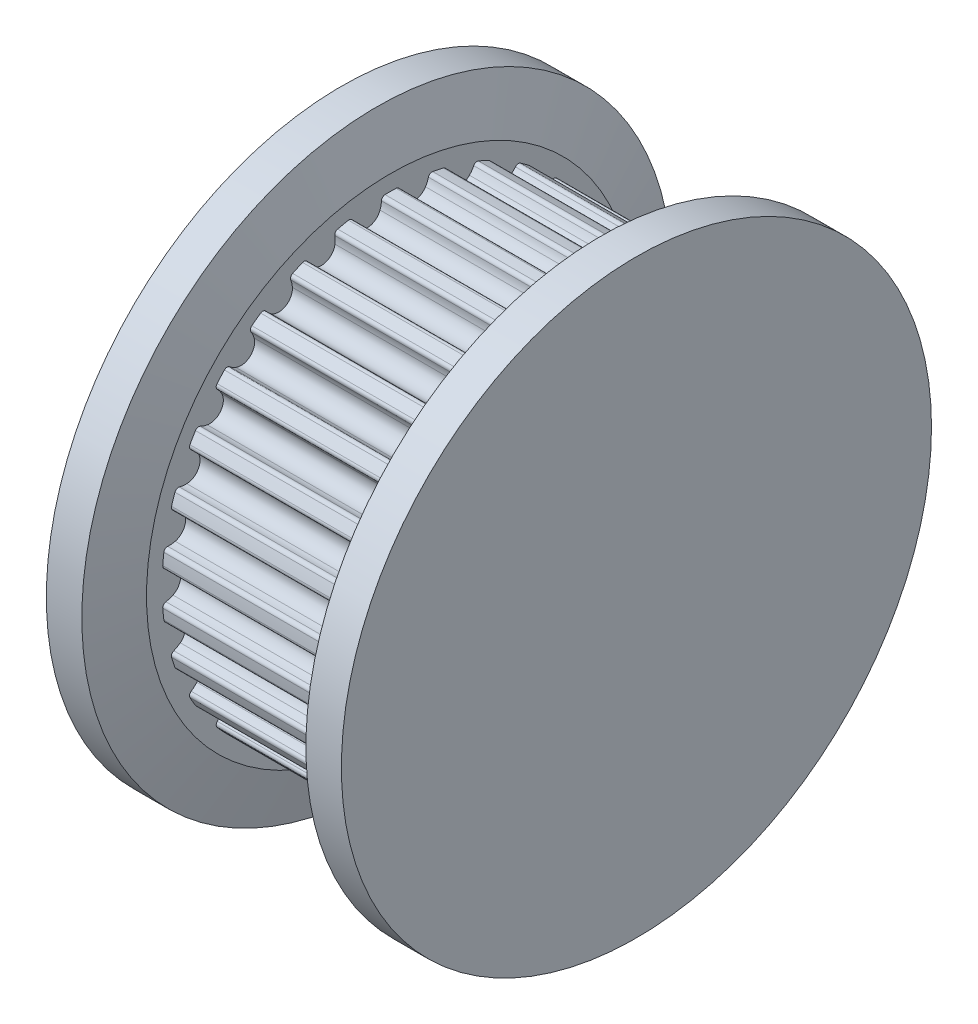
from build123d import *

# Parameters (mm, degrees)
BOSS_EXTRUDE1_DEPTH = 4


with BuildPart() as part:
    # Teeth → Boss-Extrude1 (new, symmetric)
    with BuildSketch(Plane(origin=(0, 0, 0), x_dir=(0, 0, -1), z_dir=(1, 0, 0))):
        with BuildLine():
            ThreePointArc((9.265037895, -0.749407376), (9.255373868, -0.860577234), (9.244375978, -0.971623068))
            ThreePointArc((9.244375978, -0.971623068), (9.232045811, -1.082528873), (9.218385142, -1.193278668))
            ThreePointArc((9.218385142, -1.193278668), (9.165223738, -1.289612833), (9.060624925, -1.323752174))
            ThreePointArc((9.060624925, -1.323752174), (8.90837436, -1.326213349), (8.758262534, -1.351761965))
            ThreePointArc((8.758262534, -1.351761965), (8.349896739, -1.774825341), (8.550882079, -2.327410299))
            ThreePointArc((8.550882079, -2.327410299), (8.677624497, -2.411806101), (8.815711259, -2.47598038))
            ThreePointArc((8.815711259, -2.47598038), (8.897381309, -2.54971239), (8.906764033, -2.659340721))
            ThreePointArc((8.906764033, -2.659340721), (8.874197675, -2.766071987), (8.840352389, -2.872404613))
            ThreePointArc((8.840352389, -2.872404613), (8.805233051, -2.978323274), (8.768844724, -3.083812707))
            ThreePointArc((8.768844724, -3.083812707), (8.696816025, -3.166988863), (8.587404979, -3.178634861))
            ThreePointArc((8.587404979, -3.178634861), (8.437969747, -3.149387581), (8.285826368, -3.143167895))
            ThreePointArc((8.285826368, -3.143167895), (7.798424524, -3.472082299), (7.880128979, -4.054379151))
            ThreePointArc((7.880128979, -4.054379151), (7.986554897, -4.163281933), (8.10828155, -4.254763702))
            ThreePointArc((8.10828155, -4.254763702), (8.172837166, -4.343864649), (8.159221844, -4.453048116))
            ThreePointArc((8.159221844, -4.453048116), (8.105176461, -4.550676121), (8.049962979, -4.647648293))
            ThreePointArc((8.049962979, -4.647648293), (7.993589355, -4.743950657), (7.936063714, -4.839569334))
            ThreePointArc((7.936063714, -4.839569334), (7.84831572, -4.905952282), (7.738874228, -4.894595952))
            ThreePointArc((7.738874228, -4.894595952), (7.598785366, -4.834918463), (7.451259831, -4.797202305))
            ThreePointArc((7.451259831, -4.797202305), (6.906123737, -5.017592598), (6.86497643, -5.604152179))
            ThreePointArc((6.86497643, -5.604152179), (6.946434525, -5.732802366), (7.046481028, -5.847593434))
            ThreePointArc((7.046481028, -5.847593434), (7.091100821, -5.948169178), (7.055082507, -6.052135939))
            ThreePointArc((7.055082507, -6.052135939), (6.981920142, -6.136393871), (6.907751559, -6.219767441))
            ThreePointArc((6.907751559, -6.219767441), (6.832587447, -6.302244632), (6.756438638, -6.383813558))
            ThreePointArc((6.756438638, -6.383813558), (6.656806357, -6.430502046), (6.552117538, -6.396639713))
            ThreePointArc((6.552117538, -6.396639713), (6.427497601, -6.309140208), (6.291037483, -6.241575955))
            ThreePointArc((6.291037483, -6.241575955), (5.711992203, -6.343810025), (5.549791469, -6.908996865))
            ThreePointArc((5.549791469, -6.908996865), (5.602721631, -7.051771827), (5.676715474, -7.184855272))
            ThreePointArc((5.676715474, -7.184855272), (5.699449344, -7.292510172), (5.642602211, -7.386716381))
            ThreePointArc((5.642602211, -7.386716381), (5.55352041, -7.453921764), (5.463638249, -7.520052905))
            ThreePointArc((5.463638249, -7.520052905), (5.37296868, -7.585100274), (5.281524773, -7.649054496))
            ThreePointArc((5.281524773, -7.649054496), (5.174362614, -7.674008013), (5.079001872, -7.619119624))
            ThreePointArc((5.079001872, -7.619119624), (4.975297349, -7.507622251), (4.85586661, -7.413162786))
            ThreePointArc((4.85586661, -7.413162786), (4.2682192, -7.392772512), (3.99205399, -7.911885235))
            ThreePointArc((3.99205399, -7.911885235), (4.014142917, -8.062545021), (4.058850213, -8.208104459))
            ThreePointArc((4.058850213, -8.208104459), (4.058704581, -8.318133478), (3.983513122, -8.398461872))
            ThreePointArc((3.983513122, -8.398461872), (3.882405187, -8.445677508), (3.78073773, -8.491675973))
            ThreePointArc((3.78073773, -8.491675973), (3.678525401, -8.536450638), (3.575782931, -8.579995049))
            ThreePointArc((3.575782931, -8.579995049), (3.465774395, -8.582123005), (3.383909451, -8.508607446))
            ThreePointArc((3.383909451, -8.508607446), (3.305652729, -8.377985177), (3.208471065, -8.26075883))
            ThreePointArc((3.208471065, -8.26075883), (2.637904537, -8.118635366), (2.259844595, -8.568986255))
            ThreePointArc((2.259844595, -8.568986255), (2.250126896, -8.72094631), (2.263593721, -8.872620093))
            ThreePointArc((2.263593721, -8.872620093), (2.240574952, -8.980214436), (2.150325395, -9.043154279))
            ThreePointArc((2.150325395, -9.043154279), (2.041610228, -9.068316618), (1.93260083, -9.092172053))
            ThreePointArc((1.93260083, -9.092172053), (1.823312909, -9.114717146), (1.713762217, -9.135948647))
            ThreePointArc((1.713762217, -9.135948647), (1.605715204, -9.115158041), (1.54092395, -9.026228295))
            ThreePointArc((1.54092395, -9.026228295), (1.491535222, -8.882189948), (1.420849939, -8.747320074))
            ThreePointArc((1.420849939, -8.747320074), (0.892300788, -8.489674897), (0.428869148, -8.851581456))
            ThreePointArc((0.428869148, -8.851581456), (0.387769532, -8.998200396), (0.369407321, -9.149359654))
            ThreePointArc((0.369407321, -9.149359654), (0.324521446, -9.249816931), (0.223158129, -9.292617449))
            ThreePointArc((0.223158129, -9.292617449), (0.111587106, -9.294626777), (0, -9.295296586))
            ThreePointArc((0, -9.295296586), (-0.111587106, -9.294626777), (-0.22315813, -9.292617449))
            ThreePointArc((-0.22315813, -9.292617449), (-0.324521446, -9.249816931), (-0.369407322, -9.149359654))
            ThreePointArc((-0.369407322, -9.149359654), (-0.387769532, -8.998200396), (-0.428869148, -8.851581456))
            ThreePointArc((-0.428869148, -8.851581456), (-0.892300788, -8.489674897), (-1.420849939, -8.747320074))
            ThreePointArc((-1.420849939, -8.747320074), (-1.491535222, -8.882189948), (-1.54092395, -9.026228295))
            ThreePointArc((-1.54092395, -9.026228295), (-1.605715204, -9.115158041), (-1.713762217, -9.135948647))
            ThreePointArc((-1.713762217, -9.135948647), (-1.823312909, -9.114717146), (-1.93260083, -9.092172053))
            ThreePointArc((-1.93260083, -9.092172053), (-2.041610228, -9.068316618), (-2.150325395, -9.043154279))
            ThreePointArc((-2.150325395, -9.043154279), (-2.240574952, -8.980214436), (-2.263593721, -8.872620093))
            ThreePointArc((-2.263593721, -8.872620093), (-2.250126896, -8.72094631), (-2.259844595, -8.568986255))
            ThreePointArc((-2.259844595, -8.568986255), (-2.637904537, -8.118635366), (-3.208471065, -8.26075883))
            ThreePointArc((-3.208471065, -8.26075883), (-3.305652729, -8.377985177), (-3.383909451, -8.508607446))
            ThreePointArc((-3.383909451, -8.508607446), (-3.465774395, -8.582123005), (-3.575782931, -8.579995049))
            ThreePointArc((-3.575782931, -8.579995049), (-3.678525401, -8.536450638), (-3.78073773, -8.491675973))
            ThreePointArc((-3.78073773, -8.491675973), (-3.882405188, -8.445677508), (-3.983513122, -8.398461872))
            ThreePointArc((-3.983513122, -8.398461872), (-4.058704581, -8.318133478), (-4.058850213, -8.208104459))
            ThreePointArc((-4.058850213, -8.208104459), (-4.014142917, -8.062545021), (-3.99205399, -7.911885235))
            ThreePointArc((-3.99205399, -7.911885235), (-4.2682192, -7.392772512), (-4.85586661, -7.413162786))
            ThreePointArc((-4.85586661, -7.413162786), (-4.975297349, -7.507622251), (-5.079001872, -7.619119624))
            ThreePointArc((-5.079001872, -7.619119624), (-5.174362614, -7.674008013), (-5.281524773, -7.649054496))
            ThreePointArc((-5.281524773, -7.649054496), (-5.372968681, -7.585100274), (-5.463638249, -7.520052905))
            ThreePointArc((-5.463638249, -7.520052905), (-5.55352041, -7.453921764), (-5.642602211, -7.386716381))
            ThreePointArc((-5.642602211, -7.386716381), (-5.699449344, -7.292510172), (-5.676715474, -7.184855272))
            ThreePointArc((-5.676715474, -7.184855272), (-5.602721631, -7.051771827), (-5.549791469, -6.908996865))
            ThreePointArc((-5.549791469, -6.908996865), (-5.711992203, -6.343810025), (-6.291037484, -6.241575955))
            ThreePointArc((-6.291037484, -6.241575955), (-6.427497601, -6.309140208), (-6.552117538, -6.396639713))
            ThreePointArc((-6.552117538, -6.396639713), (-6.656806357, -6.430502046), (-6.756438638, -6.383813558))
            ThreePointArc((-6.756438638, -6.383813558), (-6.832587447, -6.302244632), (-6.907751559, -6.219767441))
            ThreePointArc((-6.907751559, -6.219767441), (-6.981920142, -6.136393871), (-7.055082507, -6.052135939))
            ThreePointArc((-7.055082507, -6.052135939), (-7.091100821, -5.948169178), (-7.046481029, -5.847593434))
            ThreePointArc((-7.046481029, -5.847593434), (-6.946434525, -5.732802366), (-6.86497643, -5.604152179))
            ThreePointArc((-6.86497643, -5.604152179), (-6.906123737, -5.017592598), (-7.451259831, -4.797202305))
            ThreePointArc((-7.451259831, -4.797202305), (-7.598785366, -4.834918463), (-7.738874228, -4.894595952))
            ThreePointArc((-7.738874228, -4.894595952), (-7.84831572, -4.905952282), (-7.936063714, -4.839569334))
            ThreePointArc((-7.936063714, -4.839569334), (-7.993589355, -4.743950657), (-8.049962979, -4.647648293))
            ThreePointArc((-8.049962979, -4.647648293), (-8.105176461, -4.550676121), (-8.159221844, -4.453048116))
            ThreePointArc((-8.159221844, -4.453048116), (-8.172837166, -4.343864649), (-8.10828155, -4.254763702))
            ThreePointArc((-8.10828155, -4.254763702), (-7.986554897, -4.163281933), (-7.880128979, -4.054379151))
            ThreePointArc((-7.880128979, -4.054379151), (-7.798424525, -3.472082299), (-8.285826369, -3.143167895))
            ThreePointArc((-8.285826369, -3.143167895), (-8.437969747, -3.149387581), (-8.587404979, -3.178634861))
            ThreePointArc((-8.587404979, -3.178634861), (-8.696816025, -3.166988863), (-8.768844724, -3.083812707))
            ThreePointArc((-8.768844724, -3.083812707), (-8.805233051, -2.978323274), (-8.840352389, -2.872404613))
            ThreePointArc((-8.840352389, -2.872404613), (-8.874197675, -2.766071987), (-8.906764033, -2.659340721))
            ThreePointArc((-8.906764033, -2.659340721), (-8.897381309, -2.54971239), (-8.815711259, -2.47598038))
            ThreePointArc((-8.815711259, -2.47598038), (-8.677624497, -2.411806101), (-8.550882079, -2.327410299))
            ThreePointArc((-8.550882079, -2.327410299), (-8.34989674, -1.774825341), (-8.758262534, -1.351761965))
            ThreePointArc((-8.758262534, -1.351761965), (-8.90837436, -1.326213349), (-9.060624925, -1.323752174))
            ThreePointArc((-9.060624925, -1.323752174), (-9.165223738, -1.289612833), (-9.218385142, -1.193278668))
            ThreePointArc((-9.218385142, -1.193278668), (-9.232045811, -1.082528873), (-9.244375978, -0.971623068))
            ThreePointArc((-9.244375978, -0.971623068), (-9.255373868, -0.860577234), (-9.265037895, -0.749407376))
            ThreePointArc((-9.265037895, -0.749407376), (-9.233067195, -0.644125465), (-9.137852084, -0.588984835))
            ThreePointArc((-9.137852084, -0.588984835), (-8.989440266, -0.55492277), (-8.8479206, -0.498722449))
            ThreePointArc((-8.8479206, -0.498722449), (-8.5364384, 0), (-8.8479206, 0.498722449))
            ThreePointArc((-8.8479206, 0.498722449), (-8.989440266, 0.55492277), (-9.137852084, 0.588984835))
            ThreePointArc((-9.137852084, 0.588984835), (-9.233067195, 0.644125465), (-9.265037895, 0.749407376))
            ThreePointArc((-9.265037895, 0.749407376), (-9.255373868, 0.860577234), (-9.244375978, 0.971623068))
            ThreePointArc((-9.244375978, 0.971623068), (-9.232045811, 1.082528873), (-9.218385142, 1.193278668))
            ThreePointArc((-9.218385142, 1.193278668), (-9.165223738, 1.289612833), (-9.060624925, 1.323752174))
            ThreePointArc((-9.060624925, 1.323752174), (-8.90837436, 1.326213349), (-8.758262534, 1.351761965))
            ThreePointArc((-8.758262534, 1.351761965), (-8.34989674, 1.774825341), (-8.550882079, 2.327410299))
            ThreePointArc((-8.550882079, 2.327410299), (-8.677624497, 2.411806101), (-8.815711259, 2.47598038))
            ThreePointArc((-8.815711259, 2.47598038), (-8.897381309, 2.54971239), (-8.906764033, 2.659340721))
            ThreePointArc((-8.906764033, 2.659340721), (-8.874197675, 2.766071987), (-8.840352389, 2.872404613))
            ThreePointArc((-8.840352389, 2.872404613), (-8.805233051, 2.978323274), (-8.768844724, 3.083812707))
            ThreePointArc((-8.768844724, 3.083812707), (-8.696816025, 3.166988863), (-8.587404979, 3.178634861))
            ThreePointArc((-8.587404979, 3.178634861), (-8.437969747, 3.149387581), (-8.285826369, 3.143167895))
            ThreePointArc((-8.285826369, 3.143167895), (-7.798424525, 3.472082299), (-7.880128979, 4.054379151))
            ThreePointArc((-7.880128979, 4.054379151), (-7.986554897, 4.163281933), (-8.10828155, 4.254763702))
            ThreePointArc((-8.10828155, 4.254763702), (-8.172837166, 4.343864649), (-8.159221844, 4.453048116))
            ThreePointArc((-8.159221844, 4.453048116), (-8.105176461, 4.550676121), (-8.049962979, 4.647648293))
            ThreePointArc((-8.049962979, 4.647648293), (-7.993589355, 4.743950657), (-7.936063714, 4.839569334))
            ThreePointArc((-7.936063714, 4.839569334), (-7.84831572, 4.905952282), (-7.738874228, 4.894595952))
            ThreePointArc((-7.738874228, 4.894595952), (-7.598785366, 4.834918463), (-7.451259831, 4.797202305))
            ThreePointArc((-7.451259831, 4.797202305), (-6.906123737, 5.017592598), (-6.86497643, 5.604152179))
            ThreePointArc((-6.86497643, 5.604152179), (-6.946434525, 5.732802366), (-7.046481029, 5.847593434))
            ThreePointArc((-7.046481029, 5.847593434), (-7.091100821, 5.948169178), (-7.055082507, 6.052135939))
            ThreePointArc((-7.055082507, 6.052135939), (-6.981920142, 6.136393871), (-6.907751559, 6.219767441))
            ThreePointArc((-6.907751559, 6.219767441), (-6.832587447, 6.302244632), (-6.756438638, 6.383813558))
            ThreePointArc((-6.756438638, 6.383813558), (-6.656806357, 6.430502046), (-6.552117538, 6.396639713))
            ThreePointArc((-6.552117538, 6.396639713), (-6.427497601, 6.309140208), (-6.291037484, 6.241575955))
            ThreePointArc((-6.291037484, 6.241575955), (-5.711992203, 6.343810025), (-5.549791469, 6.908996865))
            ThreePointArc((-5.549791469, 6.908996865), (-5.602721631, 7.051771827), (-5.676715474, 7.184855272))
            ThreePointArc((-5.676715474, 7.184855272), (-5.699449344, 7.292510172), (-5.642602211, 7.386716381))
            ThreePointArc((-5.642602211, 7.386716381), (-5.55352041, 7.453921764), (-5.463638249, 7.520052905))
            ThreePointArc((-5.463638249, 7.520052905), (-5.372968681, 7.585100274), (-5.281524773, 7.649054496))
            ThreePointArc((-5.281524773, 7.649054496), (-5.174362614, 7.674008013), (-5.079001872, 7.619119624))
            ThreePointArc((-5.079001872, 7.619119624), (-4.975297349, 7.507622251), (-4.85586661, 7.413162786))
            ThreePointArc((-4.85586661, 7.413162786), (-4.2682192, 7.392772512), (-3.99205399, 7.911885235))
            ThreePointArc((-3.99205399, 7.911885235), (-4.014142917, 8.062545021), (-4.058850213, 8.208104459))
            ThreePointArc((-4.058850213, 8.208104459), (-4.058704581, 8.318133478), (-3.983513122, 8.398461872))
            ThreePointArc((-3.983513122, 8.398461872), (-3.882405188, 8.445677508), (-3.78073773, 8.491675973))
            ThreePointArc((-3.78073773, 8.491675973), (-3.678525401, 8.536450638), (-3.575782931, 8.579995049))
            ThreePointArc((-3.575782931, 8.579995049), (-3.465774395, 8.582123005), (-3.383909451, 8.508607446))
            ThreePointArc((-3.383909451, 8.508607446), (-3.305652729, 8.377985177), (-3.208471065, 8.26075883))
            ThreePointArc((-3.208471065, 8.26075883), (-2.637904537, 8.118635366), (-2.259844595, 8.568986255))
            ThreePointArc((-2.259844595, 8.568986255), (-2.250126896, 8.72094631), (-2.263593721, 8.872620093))
            ThreePointArc((-2.263593721, 8.872620093), (-2.240574952, 8.980214436), (-2.150325395, 9.043154279))
            ThreePointArc((-2.150325395, 9.043154279), (-2.041610228, 9.068316618), (-1.93260083, 9.092172053))
            ThreePointArc((-1.93260083, 9.092172053), (-1.823312909, 9.114717146), (-1.713762217, 9.135948647))
            ThreePointArc((-1.713762217, 9.135948647), (-1.605715204, 9.115158041), (-1.54092395, 9.026228295))
            ThreePointArc((-1.54092395, 9.026228295), (-1.491535222, 8.882189948), (-1.420849939, 8.747320074))
            ThreePointArc((-1.420849939, 8.747320074), (-0.892300788, 8.489674897), (-0.428869148, 8.851581456))
            ThreePointArc((-0.428869148, 8.851581456), (-0.387769532, 8.998200396), (-0.369407322, 9.149359654))
            ThreePointArc((-0.369407322, 9.149359654), (-0.324521446, 9.249816931), (-0.22315813, 9.292617449))
            ThreePointArc((-0.22315813, 9.292617449), (-0.111587106, 9.294626777), (0, 9.295296586))
            ThreePointArc((0, 9.295296586), (0.111587106, 9.294626777), (0.223158129, 9.292617449))
            ThreePointArc((0.223158129, 9.292617449), (0.324521446, 9.249816931), (0.369407321, 9.149359654))
            ThreePointArc((0.369407321, 9.149359654), (0.387769532, 8.998200396), (0.428869148, 8.851581456))
            ThreePointArc((0.428869148, 8.851581456), (0.892300788, 8.489674897), (1.420849939, 8.747320074))
            ThreePointArc((1.420849939, 8.747320074), (1.491535222, 8.882189948), (1.54092395, 9.026228295))
            ThreePointArc((1.54092395, 9.026228295), (1.605715204, 9.115158041), (1.713762217, 9.135948647))
            ThreePointArc((1.713762217, 9.135948647), (1.823312909, 9.114717146), (1.93260083, 9.092172053))
            ThreePointArc((1.93260083, 9.092172053), (2.041610228, 9.068316618), (2.150325395, 9.043154279))
            ThreePointArc((2.150325395, 9.043154279), (2.240574952, 8.980214436), (2.263593721, 8.872620093))
            ThreePointArc((2.263593721, 8.872620093), (2.250126896, 8.72094631), (2.259844595, 8.568986255))
            ThreePointArc((2.259844595, 8.568986255), (2.637904537, 8.118635366), (3.208471065, 8.26075883))
            ThreePointArc((3.208471065, 8.26075883), (3.305652729, 8.377985177), (3.383909451, 8.508607446))
            ThreePointArc((3.383909451, 8.508607446), (3.465774395, 8.582123005), (3.575782931, 8.579995049))
            ThreePointArc((3.575782931, 8.579995049), (3.678525401, 8.536450638), (3.78073773, 8.491675973))
            ThreePointArc((3.78073773, 8.491675973), (3.882405187, 8.445677508), (3.983513122, 8.398461872))
            ThreePointArc((3.983513122, 8.398461872), (4.058704581, 8.318133478), (4.058850213, 8.208104459))
            ThreePointArc((4.058850213, 8.208104459), (4.014142917, 8.062545021), (3.99205399, 7.911885235))
            ThreePointArc((3.99205399, 7.911885235), (4.2682192, 7.392772512), (4.85586661, 7.413162786))
            ThreePointArc((4.85586661, 7.413162786), (4.975297349, 7.507622251), (5.079001872, 7.619119624))
            ThreePointArc((5.079001872, 7.619119624), (5.174362614, 7.674008013), (5.281524773, 7.649054496))
            ThreePointArc((5.281524773, 7.649054496), (5.37296868, 7.585100274), (5.463638249, 7.520052905))
            ThreePointArc((5.463638249, 7.520052905), (5.55352041, 7.453921764), (5.642602211, 7.386716381))
            ThreePointArc((5.642602211, 7.386716381), (5.699449344, 7.292510172), (5.676715474, 7.184855272))
            ThreePointArc((5.676715474, 7.184855272), (5.602721631, 7.051771827), (5.549791469, 6.908996865))
            ThreePointArc((5.549791469, 6.908996865), (5.711992203, 6.343810025), (6.291037483, 6.241575955))
            ThreePointArc((6.291037483, 6.241575955), (6.427497601, 6.309140208), (6.552117538, 6.396639713))
            ThreePointArc((6.552117538, 6.396639713), (6.656806357, 6.430502046), (6.756438638, 6.383813558))
            ThreePointArc((6.756438638, 6.383813558), (6.832587447, 6.302244632), (6.907751559, 6.219767441))
            ThreePointArc((6.907751559, 6.219767441), (6.981920142, 6.136393871), (7.055082507, 6.052135939))
            ThreePointArc((7.055082507, 6.052135939), (7.091100821, 5.948169178), (7.046481028, 5.847593434))
            ThreePointArc((7.046481028, 5.847593434), (6.946434525, 5.732802366), (6.86497643, 5.604152179))
            ThreePointArc((6.86497643, 5.604152179), (6.906123737, 5.017592598), (7.451259831, 4.797202305))
            ThreePointArc((7.451259831, 4.797202305), (7.598785366, 4.834918463), (7.738874228, 4.894595952))
            ThreePointArc((7.738874228, 4.894595952), (7.84831572, 4.905952282), (7.936063714, 4.839569334))
            ThreePointArc((7.936063714, 4.839569334), (7.993589355, 4.743950657), (8.049962979, 4.647648293))
            ThreePointArc((8.049962979, 4.647648293), (8.105176461, 4.550676121), (8.159221844, 4.453048116))
            ThreePointArc((8.159221844, 4.453048116), (8.172837166, 4.343864649), (8.10828155, 4.254763702))
            ThreePointArc((8.10828155, 4.254763702), (7.986554897, 4.163281933), (7.880128979, 4.054379151))
            ThreePointArc((7.880128979, 4.054379151), (7.798424524, 3.472082299), (8.285826368, 3.143167895))
            ThreePointArc((8.285826368, 3.143167895), (8.437969747, 3.149387581), (8.587404979, 3.178634861))
            ThreePointArc((8.587404979, 3.178634861), (8.696816025, 3.166988863), (8.768844724, 3.083812707))
            ThreePointArc((8.768844724, 3.083812707), (8.805233051, 2.978323274), (8.840352389, 2.872404613))
            ThreePointArc((8.840352389, 2.872404613), (8.874197675, 2.766071987), (8.906764033, 2.659340721))
            ThreePointArc((8.906764033, 2.659340721), (8.897381309, 2.54971239), (8.815711259, 2.47598038))
            ThreePointArc((8.815711259, 2.47598038), (8.677624497, 2.411806101), (8.550882079, 2.327410299))
            ThreePointArc((8.550882079, 2.327410299), (8.349896739, 1.774825341), (8.758262534, 1.351761965))
            ThreePointArc((8.758262534, 1.351761965), (8.90837436, 1.326213349), (9.060624925, 1.323752174))
            ThreePointArc((9.060624925, 1.323752174), (9.165223738, 1.289612833), (9.218385142, 1.193278668))
            ThreePointArc((9.218385142, 1.193278668), (9.232045811, 1.082528873), (9.244375978, 0.971623068))
            ThreePointArc((9.244375978, 0.971623068), (9.255373868, 0.860577234), (9.265037895, 0.749407376))
            ThreePointArc((9.265037895, 0.749407376), (9.233067195, 0.644125465), (9.137852084, 0.588984835))
            ThreePointArc((9.137852084, 0.588984835), (8.989440266, 0.55492277), (8.8479206, 0.498722449))
            ThreePointArc((8.8479206, 0.498722449), (8.5364384, 0), (8.8479206, -0.498722449))
            ThreePointArc((8.8479206, -0.498722449), (8.989440266, -0.55492277), (9.137852084, -0.588984835))
            ThreePointArc((9.137852084, -0.588984835), (9.233067195, -0.644125465), (9.265037895, -0.749407376))
        make_face()
    extrude(amount=BOSS_EXTRUDE1_DEPTH, both=True)

    # Sketch3 → Revolve1 (revolve)
    with BuildSketch(Plane.XY):
        Polygon((-4, 0), (-4, 9.925296586), (-4.555915104, 12), (-6, 12), (-6, 0), align=None)
        Polygon((4, 0), (6, 0), (6, 12), (4.555915104, 12), (4, 9.925296586), align=None)
    revolve(axis=Axis((4, 0, 0), (-1, 0, 0)))


solid = part.part
